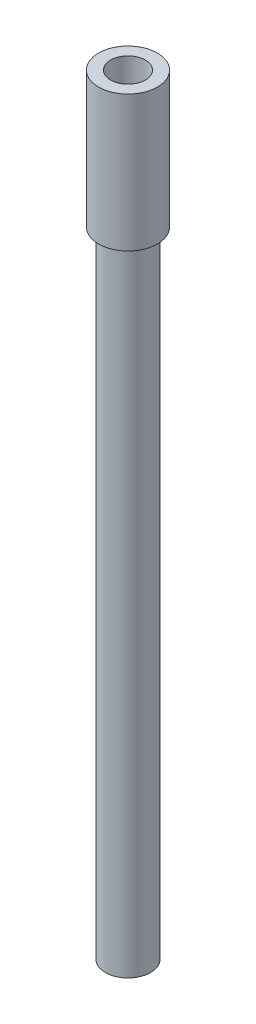
from build123d import *

# Parameters (mm, degrees)
SKETCH3_R           = 2.5
BOSS_EXTRUDE2_DEPTH = 70
SKETCH4_R           = 3.25
BOSS_EXTRUDE3_DEPTH = 15
SKETCH5_R           = 1.918799899
CUT_EXTRUDE1_DEPTH  = 5


with BuildPart() as part:
    # Sketch3 → Boss-Extrude2 (new body)
    with BuildSketch(Plane(origin=(0, 0, 0), x_dir=(1, 0, 0), z_dir=(0, 1, 0))):
        Circle(SKETCH3_R)
    extrude(amount=BOSS_EXTRUDE2_DEPTH)

    # Sketch4 → Boss-Extrude3 (add)
    with BuildSketch(Plane(origin=(0, 70, 0), x_dir=(1, 0, 0), z_dir=(0, 1, 0))):
        Circle(SKETCH4_R)
    extrude(amount=BOSS_EXTRUDE3_DEPTH)

    # Sketch5 → Cut-Extrude1 (cut)
    with BuildSketch(Plane(origin=(0, 85, 0), x_dir=(1, 0, 0), z_dir=(0, 1, 0))):
        Circle(SKETCH5_R)
    extrude(amount=-CUT_EXTRUDE1_DEPTH, mode=Mode.SUBTRACT)


solid = part.part
